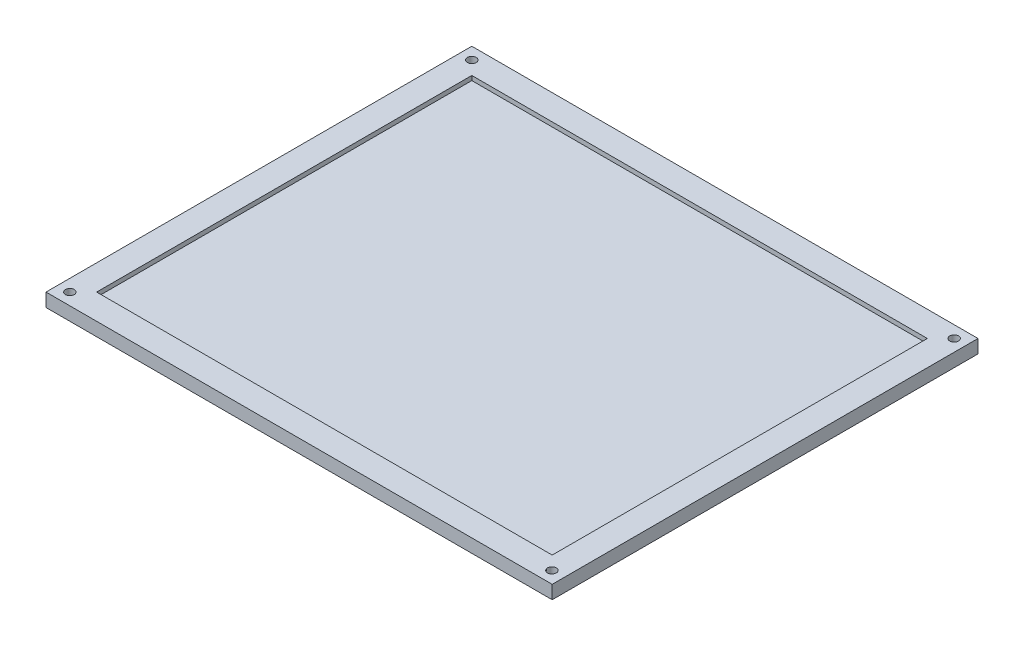
from build123d import *

# Parameters (mm, degrees)
SKETCH1_W           = 188.9
SKETCH1_H           = 158.9
BOSS_EXTRUDE1_DEPTH = 5
SKETCH2_W           = 170
SKETCH2_H           = 140
CUT_EXTRUDE1_DEPTH  = 1.66
SKETCH3_R           = 1.65
CUT_EXTRUDE2_DEPTH  = 5
SKETCH6_R           = 1.65
CUT_EXTRUDE4_DEPTH  = 10


with BuildPart() as part:
    # Sketch1 → Boss-Extrude1 (new body)
    with BuildSketch(Plane(origin=(0, 0, 0), x_dir=(1, 0, 0), z_dir=(0, 1, 0))):
        Rectangle(SKETCH1_W, SKETCH1_H)
    extrude(amount=BOSS_EXTRUDE1_DEPTH)

    # Sketch2 → Cut-Extrude1 (cut)
    with BuildSketch(Plane(origin=(0, 5, 0), x_dir=(1, 0, 0), z_dir=(0, 1, 0))):
        Rectangle(SKETCH2_W, SKETCH2_H)
    extrude(amount=-CUT_EXTRUDE1_DEPTH, mode=Mode.SUBTRACT)

    # Sketch3 → Cut-Extrude2 (cut)
    with BuildSketch(Plane(origin=(0, 5, 0), x_dir=(1, 0, 0), z_dir=(0, 1, 0))):
        with Locations((-90, 75)):
            Circle(SKETCH3_R)
    extrude(amount=-CUT_EXTRUDE2_DEPTH, mode=Mode.SUBTRACT)

    # Sketch6 → Cut-Extrude4 (cut)
    with BuildSketch(Plane(origin=(0, 5, 0), x_dir=(1, 0, 0), z_dir=(0, 1, 0))):
        with Locations((-90, -75)):
            Circle(SKETCH6_R)
        with Locations((89.9, -75)):
            Circle(SKETCH6_R)
        with Locations((90, 75)):
            Circle(SKETCH6_R)
    extrude(amount=-CUT_EXTRUDE4_DEPTH, mode=Mode.SUBTRACT)


solid = part.part
